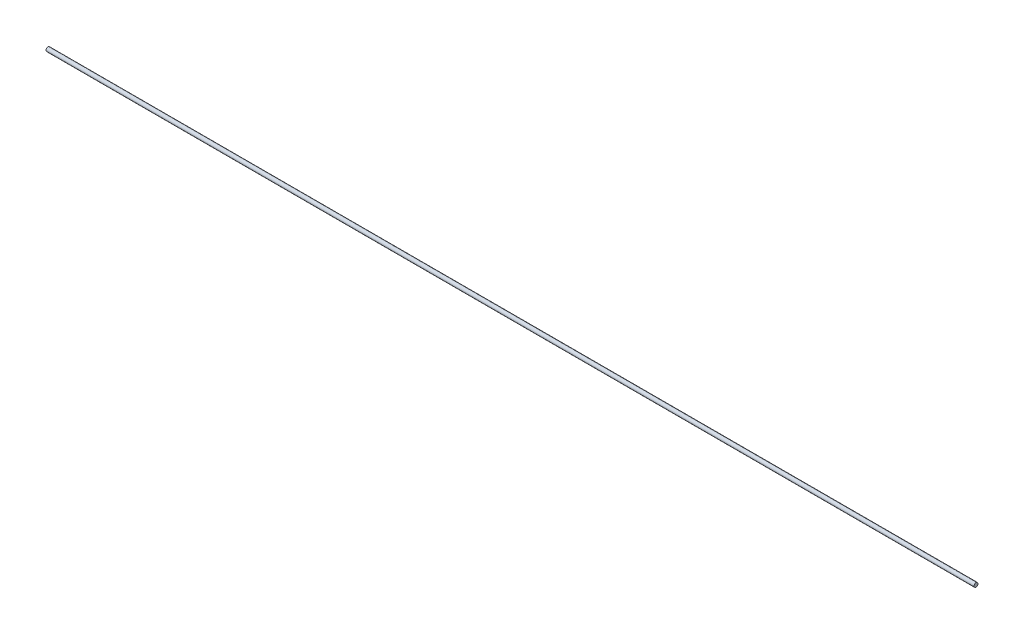
from build123d import *

# Parameters (mm, degrees)
SKETCH1_W = 1469.480513378
SKETCH1_H = 3.175


with BuildPart() as part:
    # Sketch1 → Revolve1 (revolve)
    with BuildSketch(Plane.XY):
        with Locations((734.740256689, 1.5875)):
            Rectangle(SKETCH1_W, SKETCH1_H)
    revolve(axis=Axis((0, 0, 0), (1, 0, 0)))


solid = part.part
